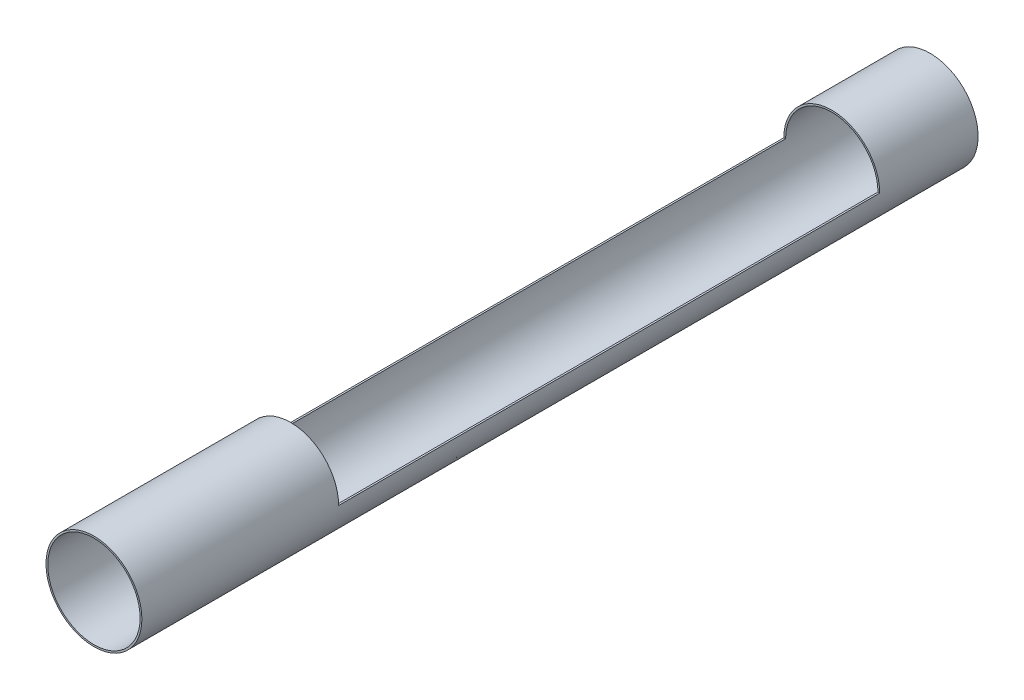
from build123d import *

# Parameters (mm, degrees)
BOSS_EXTRUDE1_DEPTH = 558.8
SKETCH2_R           = 49.5046
SKETCH2_R_2         = 47.6885
BOSS_EXTRUDE2_DEPTH = 203.2
BOSS_EXTRUDE3_START = 101.6
SKETCH3_R           = 49.5046
SKETCH3_R_2         = 47.6885
BOSS_EXTRUDE3_DEPTH = 101.6


with BuildPart() as part:
    # Sketch1 → Boss-Extrude1 (new body)
    with BuildSketch(Plane.XY):
        with BuildLine():
            Line((-49.5046, 0), (-47.6885, 0))
            ThreePointArc((-47.6885, 0), (0, -47.6885), (47.6885, 0))
            Line((47.6885, 0), (49.5046, 0))
            ThreePointArc((49.5046, 0), (0, -49.5046), (-49.5046, 0))
        make_face()
    extrude(amount=BOSS_EXTRUDE1_DEPTH)

    # Sketch2 → Boss-Extrude2 (add)
    with BuildSketch(Plane.XY.offset(558.8)):
        Circle(SKETCH2_R)
        Circle(SKETCH2_R_2, mode=Mode.SUBTRACT)
    extrude(amount=BOSS_EXTRUDE2_DEPTH)

    # Sketch3 → Boss-Extrude3 (add)
    with BuildSketch(Plane(origin=(0, 0, 0), x_dir=(-1, 0, 0), z_dir=(0, 0, -1)).offset(BOSS_EXTRUDE3_START)):
        Circle(SKETCH3_R)
        Circle(SKETCH3_R_2, mode=Mode.SUBTRACT)
    extrude(amount=-BOSS_EXTRUDE3_DEPTH)


solid = part.part
